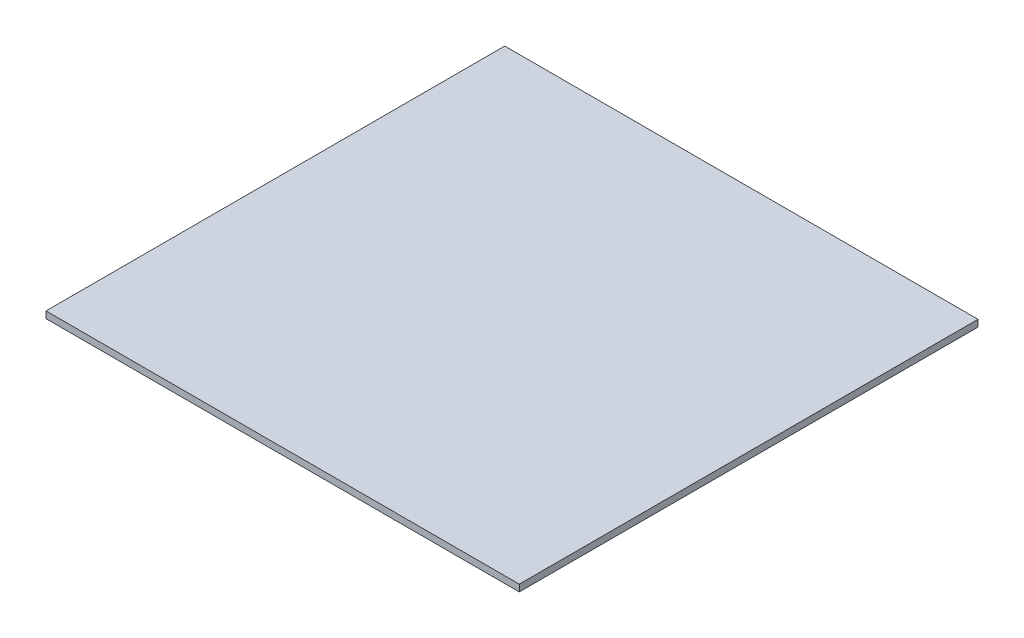
from build123d import *

# Parameters (mm, degrees)
SKETCH1_W           = 222.758
SKETCH1_H           = 215.9
BOSS_EXTRUDE1_DEPTH = 3.175


with BuildPart() as part:
    # Sketch1 → Boss-Extrude1 (new body)
    with BuildSketch(Plane(origin=(0, 0, 0), x_dir=(1, 0, 0), z_dir=(0, 1, 0))):
        with Locations((111.379, 107.95)):
            Rectangle(SKETCH1_W, SKETCH1_H)
    extrude(amount=BOSS_EXTRUDE1_DEPTH)


solid = part.part
